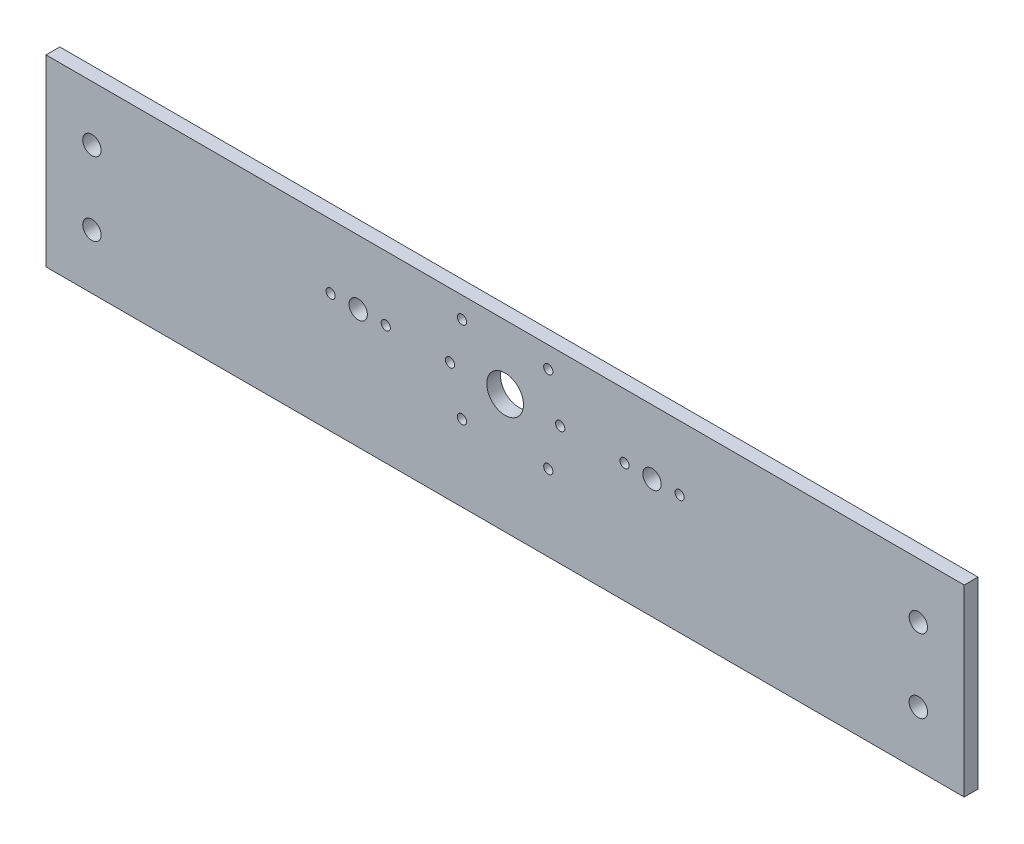
from build123d import *

# Parameters (mm, degrees)
SKETCH2_W           = 500
SKETCH2_H           = 100
BOSS_EXTRUDE1_DEPTH = 7.5
SKETCH9_R           = 5
SKETCH9_R_2         = 2.5
SKETCH9_R_3         = 10
CUT_EXTRUDE3_DEPTH  = 510.957106039
SKETCH11_R          = 5
CUT_EXTRUDE4_DEPTH  = 510.957106039


with BuildPart() as part:
    # Sketch2 → Boss-Extrude1 (new body)
    with BuildSketch(Plane.XY):
        with Locations((250, 50)):
            Rectangle(SKETCH2_W, SKETCH2_H)
    extrude(amount=BOSS_EXTRUDE1_DEPTH)

    # Sketch9 → Cut-Extrude3 (cut, through all)
    with BuildSketch(Plane.XY.offset(7.5)):
        with Locations((170, 65)):
            Circle(SKETCH9_R)
        with Locations((185, 65)):
            Circle(SKETCH9_R_2)
        with Locations((155, 65)):
            Circle(SKETCH9_R_2)
        with Locations((330, 65)):
            Circle(SKETCH9_R)
        with Locations((345, 65)):
            Circle(SKETCH9_R_2)
        with Locations((315, 65)):
            Circle(SKETCH9_R_2)
        with Locations((250, 65)):
            Circle(SKETCH9_R_3)
        with Locations((280, 65)):
            Circle(SKETCH9_R_2)
        with Locations((220, 65)):
            Circle(SKETCH9_R_2)
        with Locations((226.5, 88.5)):
            Circle(SKETCH9_R_2)
        with Locations((273.5, 88.5)):
            Circle(SKETCH9_R_2)
        with Locations((273.5, 41.5)):
            Circle(SKETCH9_R_2)
        with Locations((226.5, 41.5)):
            Circle(SKETCH9_R_2)
    extrude(amount=-CUT_EXTRUDE3_DEPTH, mode=Mode.SUBTRACT)

    # Sketch11 → Cut-Extrude4 (cut, through all)
    with BuildSketch(Plane.XY.offset(7.5)):
        with Locations((25, 70)):
            Circle(SKETCH11_R)
        with Locations((25, 30)):
            Circle(SKETCH11_R)
        with Locations((475, 30)):
            Circle(SKETCH11_R)
        with Locations((475, 70)):
            Circle(SKETCH11_R)
    extrude(amount=-CUT_EXTRUDE4_DEPTH, mode=Mode.SUBTRACT)


solid = part.part
